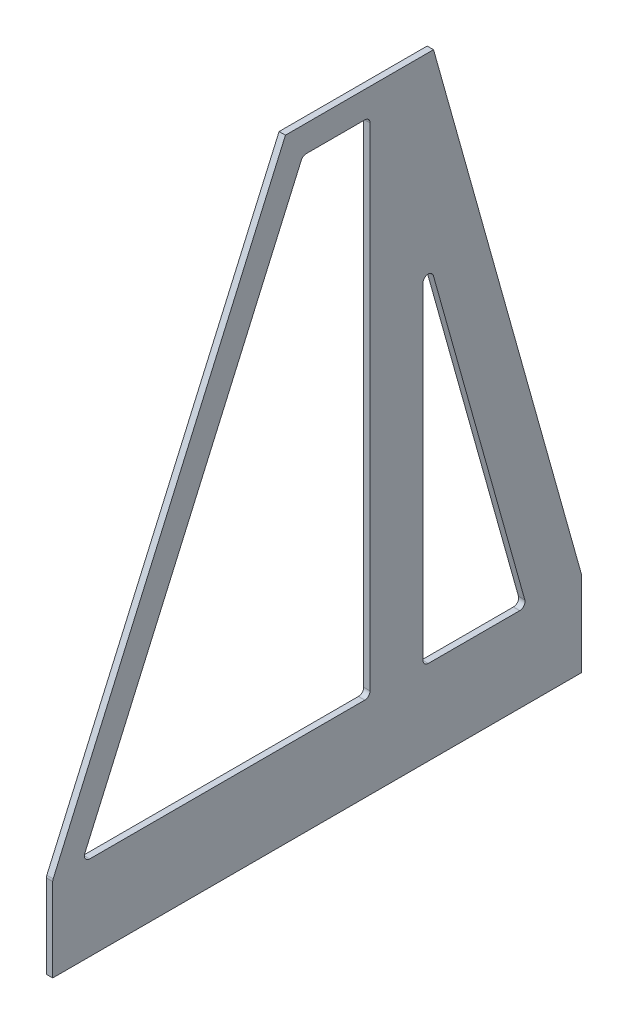
from build123d import *

# Parameters (mm, degrees)
EXTRUDE_740_DEPTH = 6


with BuildPart() as part:
    # Sketch 731 → Extrude 740 (new body)
    with BuildSketch(Plane(origin=(0, 0, 0), x_dir=(0, 0, -1), z_dir=(1, 0, 0))):
        with BuildLine():
            Line((-623.846153846, -244.461538462), (-123.846153846, -244.461538462))
            Line((-123.846153846, -244.461538462), (-123.846153846, -165.148331298))
            ThreePointArc((-123.846153846, -165.148331298), (-123.892665152, -164.467927188), (-124.031333748, -163.800181671))
            Line((-124.031333748, -163.800181671), (-263.846153846, 335.538461538))
            Line((-263.846153846, 335.538461538), (-313.846153846, 335.538461538))
            Line((-313.846153846, 335.538461538), (-403.846153846, 335.538461538))
            Line((-403.846153846, 335.538461538), (-623.422729008, -163.499209285))
            ThreePointArc((-623.422729008, -163.499209285), (-623.739152712, -164.484037887), (-623.846153846, -165.512902356))
            Line((-623.846153846, -165.512902356), (-623.846153846, -244.461538462))
        make_face()
        with BuildLine():
            Line((-323.846153846, 305.538461538), (-323.846153846, -159.461538462))
            ThreePointArc((-323.846153846, -159.461538462), (-325.31061994, -162.997072367), (-328.846153846, -164.461538462))
            Line((-328.846153846, -164.461538462), (-588.870553165, -164.461538462))
            ThreePointArc((-588.870553165, -164.461538462), (-593.057942887, -162.193894098), (-593.447128327, -157.44784539))
            Line((-593.447128327, -157.44784539), (-388.847128327, 307.55215461))
            ThreePointArc((-388.847128327, 307.55215461), (-387.002908801, 309.72585126), (-384.270553165, 310.538461538))
            Line((-384.270553165, 310.538461538), (-328.846153846, 310.538461538))
            ThreePointArc((-328.846153846, 310.538461538), (-325.31061994, 309.073995444), (-323.846153846, 305.538461538))
        make_face(mode=Mode.SUBTRACT)
        with BuildLine():
            Line((-268.846153846, -164.461538462), (-182.361475783, -164.461538462))
            ThreePointArc((-182.361475783, -164.461538462), (-178.377711977, -162.483065547), (-177.546655685, -158.113388834))
            Line((-177.546655685, -158.113388834), (-264.031333748, 150.76046139))
            ThreePointArc((-264.031333748, 150.76046139), (-269.526557957, 154.365800457), (-273.846153846, 149.412311762))
            Line((-273.846153846, 149.412311762), (-273.846153846, -159.461538462))
            ThreePointArc((-273.846153846, -159.461538462), (-272.381687752, -162.997072367), (-268.846153846, -164.461538462))
        make_face(mode=Mode.SUBTRACT)
    extrude(amount=EXTRUDE_740_DEPTH)


solid = part.part
